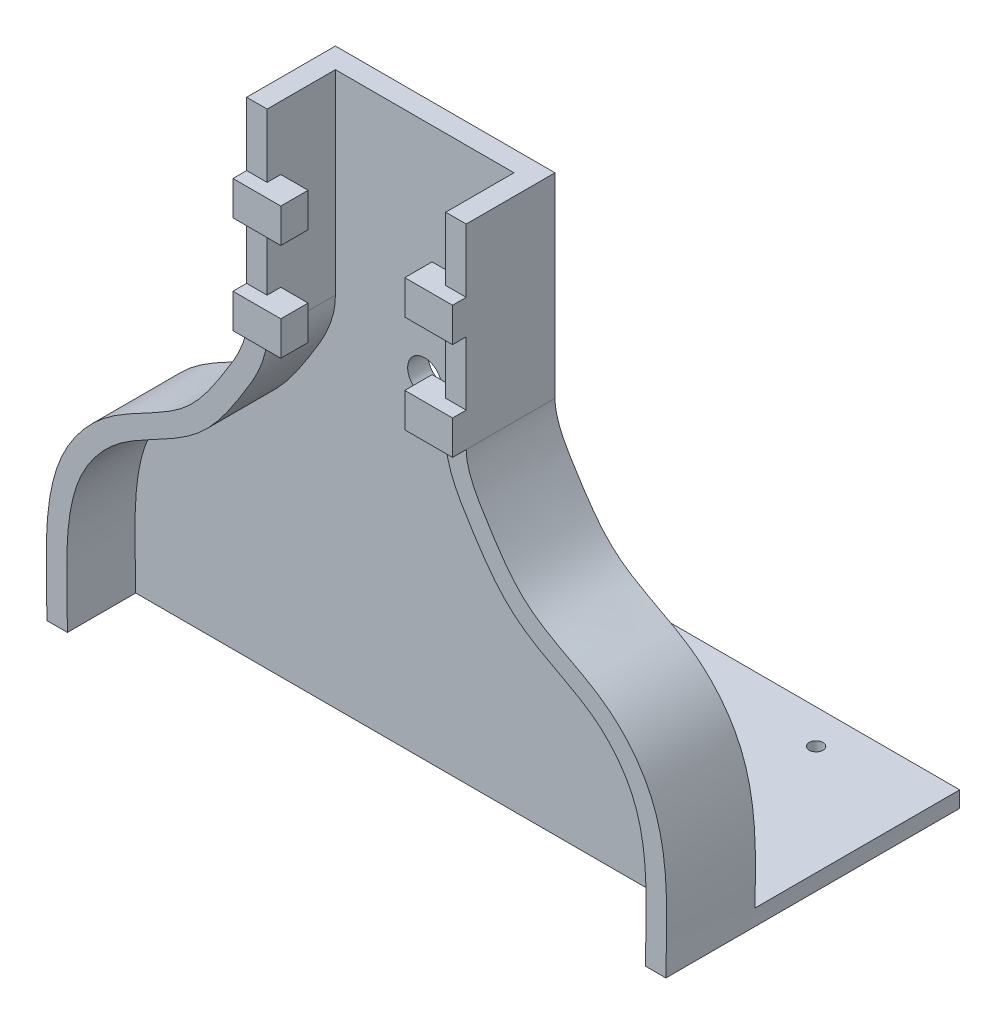
from build123d import *

# Parameters (mm, degrees)
ESTRUSIONE_ESTRUSIONE1_DEPTH = 33
ESTRUSIONE_SOTTILE5_DEPTH    = 10
SCHIZZO6_W                   = 110.84711329
SCHIZZO6_H                   = 34.53219383
TAGLIO_ESTRUSIONE1_DEPTH     = 78.62
SCHIZZO10_W                  = 7
SCHIZZO10_H                  = 5
ESTRUSIONE_ESTRUSIONE3_DEPTH = 2
FORO_PER_VITE_M4_2_D         = 5
FORO_PER_VITE_M4_2_DEPTH     = 10
FORO_PER_VITE_M4_2_TIP       = 1.502151548
SCHIZZO11_R                  = 1
TAGLIO_ESTRUSIONE2_DEPTH     = 3


# Read off the part's stored shape, not the designer's step: Estrusione-Sottile5
with BuildPart() as part:
    # Schizzo1 → Estrusione-Estrusione1 (new body)
    with BuildSketch(Plane.XY):
        with BuildLine():
            Line((32.3920487, 64.599216546), (32.3920487, 93.199228267))
            Line((32.3920487, 93.199228267), (48.470036729, 93.199228267))
            Line((48.470036729, 93.199228267), (48.470036729, 12.199228267))
            Line((48.470036729, 12.199228267), (3.151561413, 12.199228267))
            add(Edge.make_bspline(
                [(3.151561413, 12.199228267), (3.139611177, 19.224996267), (1.892686637, 31.387863298), (12.137321926, 43.966124148), (23.267751598, 47.670295467), (28.997328985, 56.366188951), (32.3920487, 61.880405589), (32.3920487, 64.599216546)],
                knots=[0, 0, 0, 0, 0.347386822, 0.514075999, 0.722780372, 0.866740614, 1, 1, 1, 1], degree=3))
        make_face()
    estrusione_estrusione1 = extrude(amount=ESTRUSIONE_ESTRUSIONE1_DEPTH)

    # Estrusione-Sottile5 outline → Estrusione-Sottile5 (add)
    with BuildSketch(Plane.XY.offset(33)):
        with BuildLine():
            Line((32.3920487, 93.199228267), (32.3920487, 64.599216546))
            add(Edge.make_bspline(
                [(32.3920487, 64.599216546), (32.3920487, 61.880405589), (28.997328985, 56.366188951), (23.267751598, 47.670295467), (12.137321926, 43.966124148), (1.892686637, 31.387863298), (3.139611177, 19.224996267), (3.151561413, 12.199228267)],
                knots=[0, 0, 0, 0, 0.133259386, 0.277219628, 0.485924001, 0.652613178, 1, 1, 1, 1], degree=3))
            Line((3.151561413, 12.199228267), (6.151557074, 12.204331005))
            add(Edge.make_bspline(
                [(6.151557074, 12.204331005), (6.149334866, 13.510808651), (6.119648943, 14.831885644), (6.06293225, 17.480029501), (6.03584378, 18.807019929), (6.037068448, 22.752005394), (6.151453161, 25.333469119), (6.757390346, 28.929919641), (7.030718923, 30.082494468), (7.57350109, 31.725152792), (7.776519692, 32.258469787), (8.231352372, 33.295835374), (8.485381605, 33.804131964), (9.889253187, 36.299307042), (11.433784909, 38.123415419), (13.69240187, 39.947060574), (14.157760625, 40.286091152), (15.150594798, 40.947311626), (15.673944983, 41.267323739), (17.308950011, 42.213099328), (18.485640453, 42.822946504), (20.909634026, 44.126845944), (22.157818902, 44.820909202), (23.995293063, 46.057426343), (24.601789725, 46.502652624), (25.48644282, 47.23845245), (25.775807333, 47.494631032), (26.331807302, 48.016372792), (26.600288227, 48.283277702), (27.899876834, 49.642128534), (28.802450288, 50.804747978), (30.05266046, 52.580806918), (30.452110657, 53.178644998), (31.036934657, 54.076643069), (31.229471218, 54.376192918), (31.61150898, 54.974569074), (31.800421327, 55.271652753), (32.379300522, 56.190094836), (32.774413439, 56.829941685), (33.536773588, 58.171274416), (33.90437134, 58.872854876), (34.558322607, 60.355334084), (34.845244987, 61.13702646), (35.262518462, 62.798404364), (35.3920487, 63.680139971), (35.3920487, 64.599216546)],
                knots=[0, 0, 0, 0, 0.0625, 0.0625, 0.125, 0.125, 0.25, 0.25, 0.3125, 0.3125, 0.34375, 0.34375, 0.375, 0.375, 0.5, 0.5, 0.53125, 0.53125, 0.5625, 0.5625, 0.625, 0.625, 0.6875, 0.6875, 0.71875, 0.71875, 0.734375, 0.734375, 0.75, 0.75, 0.8125, 0.8125, 0.84375, 0.84375, 0.859375, 0.859375, 0.875, 0.875, 0.90625, 0.90625, 0.9375, 0.9375, 0.96875, 0.96875, 1, 1, 1, 1], degree=3))
            Line((35.3920487, 64.599216546), (35.3920487, 93.199228267))
            Line((35.3920487, 93.199228267), (32.3920487, 93.199228267))
        make_face()
    estrusione_sottile5 = extrude(amount=ESTRUSIONE_SOTTILE5_DEPTH)

    # Specchia1: Estrusione-Estrusione1, Estrusione-Sottile5 across plane
    add(estrusione_estrusione1.mirror(Plane(origin=(48.470036729, 12.199228267, 33), x_dir=(0, 0, 1), z_dir=(-1, 0, 0))))
    add(estrusione_sottile5.mirror(Plane(origin=(48.470036729, 12.199228267, 33), x_dir=(0, 0, 1), z_dir=(-1, 0, 0))))

    # Schizzo6 → Taglio-Estrusione1 (cut)
    with BuildSketch(Plane(origin=(0, 93.199228267, 0), x_dir=(1, 0, 0), z_dir=(0, 1, 0))):
        with Locations((52.138692512, -12.733903085)):
            Rectangle(SCHIZZO6_W, SCHIZZO6_H)
    extrude(amount=-TAGLIO_ESTRUSIONE1_DEPTH, mode=Mode.SUBTRACT)

    # Schizzo10 → Estrusione-Estrusione3 (add, symmetric)
    with BuildSketch(Plane.XY.offset(43)):
        with Locations((35.8920487, 67.099216546)):
            Rectangle(SCHIZZO10_W, SCHIZZO10_H)
        with Locations((35.8920487, 81.399222406)):
            Rectangle(SCHIZZO10_W, SCHIZZO10_H)
        with Locations((61.048024757, 67.099216546)):
            Rectangle(SCHIZZO10_W, SCHIZZO10_H)
        with Locations((61.048024757, 81.399222406)):
            Rectangle(SCHIZZO10_W, SCHIZZO10_H)
    extrude(amount=ESTRUSIONE_ESTRUSIONE3_DEPTH, both=True)

    # Foro per Vite M4-2
    with Locations(Plane.XY.offset(33)):
        with Locations((48.470036729, 60.699133604)):
            Hole(FORO_PER_VITE_M4_2_D / 2, depth=FORO_PER_VITE_M4_2_DEPTH)
            with Locations((0, 0, -(FORO_PER_VITE_M4_2_DEPTH + FORO_PER_VITE_M4_2_TIP / 2))):  # 118° drill point
                Cone(0, FORO_PER_VITE_M4_2_D / 2, FORO_PER_VITE_M4_2_TIP, mode=Mode.SUBTRACT)

    # Schizzo11 → Taglio-Estrusione2 (cut)
    with BuildSketch(Plane.XZ.offset(-12.199228267)):
        with Locations((19.151561413, 5)):
            Circle(SCHIZZO11_R)
        with Locations((77.788512044, 5)):
            Circle(SCHIZZO11_R)
    extrude(amount=-TAGLIO_ESTRUSIONE2_DEPTH, mode=Mode.SUBTRACT)


solid = part.part
